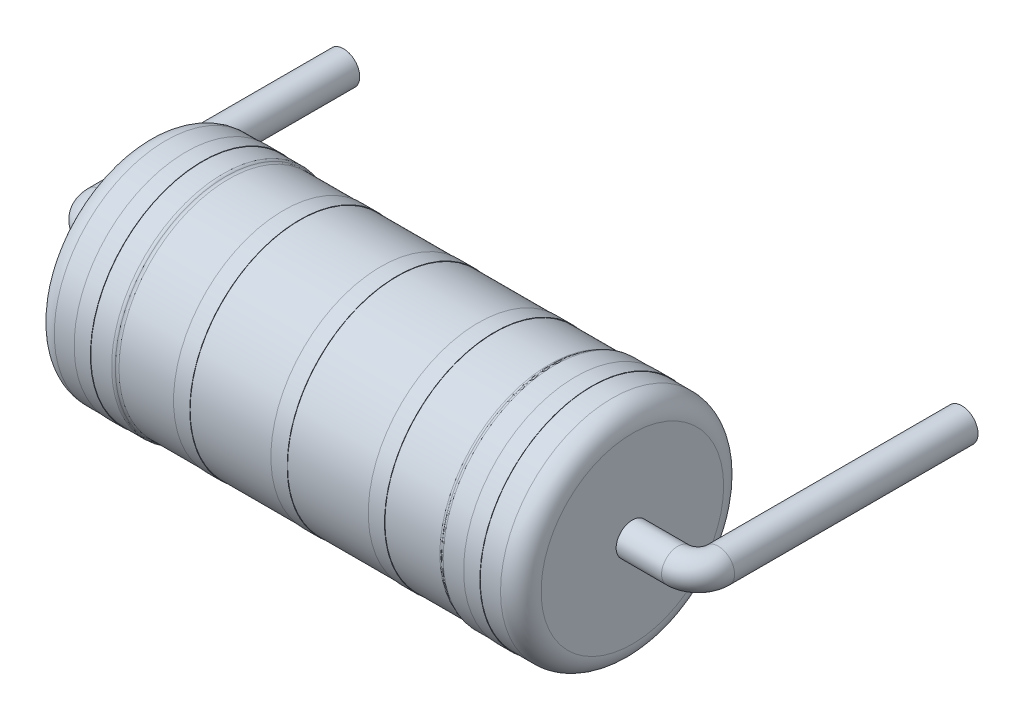
from build123d import *

# Parameters (mm, degrees)
SKETCH_1_R          = 2.75
EXTRUDE_1_DEPTH     = 6
SKETCH_5_OUTSIDE_W  = 10.36
SKETCH_5_OUTSIDE_H  = 10.36
SKETCH_5_OUTSIDE_R  = 2.7
CUT_EXTRUDE_2_DEPTH = 4
FILLET_10_R         = 0.1
FILLET_11_R         = 0.1
FILLET_13_R         = 0.5
SKETCH_6_R          = 2.76
EXTRUDE_2_DEPTH     = 0.2
SKETCH_7_R          = 2.76
EXTRUDE_3_DEPTH     = 0.2
SKETCH_8_R          = 2.71
EXTRUDE_4_DEPTH     = 0.2
SKETCH_9_R          = 2.71
EXTRUDE_5_DEPTH     = 0.2
SKETCH_10_R         = 2.71
EXTRUDE_6_DEPTH     = 0.2
SKETCH_13_R         = 0.4


with BuildPart() as part:
    # 草图1 → 拉伸1 (new, symmetric)
    with BuildSketch(Plane(origin=(0, 0, 0), x_dir=(0, 0, -1), z_dir=(1, 0, 0))):
        with Locations((-4.5, 0)):
            Circle(SKETCH_1_R)
    extrude(amount=EXTRUDE_1_DEPTH, both=True)

    # 草图5 outside → 切除-拉伸2 (cut, symmetric)
    with BuildSketch(Plane(origin=(0, 0, 0), x_dir=(0, 0, -1), z_dir=(1, 0, 0))):
        with Locations((-4.5, 0)):
            Rectangle(SKETCH_5_OUTSIDE_W, SKETCH_5_OUTSIDE_H)
        with Locations((-4.5, 0)):
            Circle(SKETCH_5_OUTSIDE_R, mode=Mode.SUBTRACT)
    extrude(amount=CUT_EXTRUDE_2_DEPTH, both=True, mode=Mode.SUBTRACT)

    # 圆角10
    # the kernel refuses this fillet: 0.1 mm, written as the material it takes off along each edge
    with BuildSketch(Plane(origin=(4, 0, 4.5), x_dir=(0, 0, -1), z_dir=(0, -1, 0))) as fillet_10_piece_1:
        with BuildLine():
            CenterArc((2.65, 0.08660254), FILLET_10_R, 300, 60)
            Line((2.75, 0.08660254), (2.752, 0.08660254))
            Line((2.752, 0.08660254), (2.752, 0))
            Line((2.752, 0), (2.75, -0.002))
            ThreePointArc((2.75, -0.002), (2.725, -0.002), (2.701, -0.001732051))
            Line((2.701, -0.001732051), (2.7, 0))
        make_face()
    revolve(axis=Axis((4, 0, 4.5), (1, 0, 0)), mode=Mode.SUBTRACT)
    with BuildSketch(Plane(origin=(-4, 0, 4.5), x_dir=(0, 0, -1), z_dir=(0, -1, 0))) as fillet_10_piece_2:
        with BuildLine():
            CenterArc((2.65, -0.08660254), FILLET_10_R, 0, 60)
            Line((2.7, 0), (2.701, 0.001732051))
            ThreePointArc((2.701, 0.001732051), (2.725, 0.002), (2.75, 0.002))
            Line((2.75, 0.002), (2.752, 0))
            Line((2.752, 0), (2.752, -0.08660254))
            Line((2.752, -0.08660254), (2.75, -0.08660254))
        make_face()
    revolve(axis=Axis((-4, 0, 4.5), (1, 0, 0)), mode=Mode.SUBTRACT)

    # 圆角11
    fillet_11_edges = [part.edges().sort_by_distance(p)[0] for p in [
        (4, 0, 7.2),
        (-4, 0, 7.2),
    ]]
    fillet(fillet_11_edges, radius=FILLET_11_R)

    # 圆角13
    fillet_13_edges = [part.edges().sort_by_distance(p)[0] for p in [
        (-6, 0, 7.25),
        (6, 0, 7.25),
    ]]
    fillet(fillet_13_edges, radius=FILLET_13_R)

    # 扫描1: sweep along a path in 草图12
    with BuildLine(Plane(origin=(0, 0, 0), x_dir=(1, 0, 0), z_dir=(0, 1, 0))) as sweep_1_path:
        Line((-6, -4.5), (-7.12, -4.5))
        ThreePointArc((-7.12, -4.5), (-7.473553391, -4.353553391), (-7.62, -4))
        Line((-7.62, -4), (-7.62, 2))
    # 草图13 → 扫描1 (sweep)
    with BuildSketch(Plane(origin=(-6, 0, 0), x_dir=(0, 0, -1), z_dir=(1, 0, 0))):
        with Locations((-4.5, 0)):
            Circle(SKETCH_13_R)
    sweep_1 = sweep(path=sweep_1_path.line)

    # 镜向3: 扫描1 across plane
    add(sweep_1.mirror(Plane(origin=(0, 0, 0), x_dir=(0, 0, 1), z_dir=(1, 0, 0))))


with BuildPart() as body_2:
    # 草图6 → 拉伸2 (new, symmetric)
    with BuildSketch(Plane(origin=(4.8, 0, 0), x_dir=(0, 0, -1), z_dir=(1, 0, 0))):
        with Locations((-4.5, 0)):
            Circle(SKETCH_6_R)
    extrude(amount=EXTRUDE_2_DEPTH, both=True)


with BuildPart() as body_3:
    # 草图7 → 拉伸3 (new, symmetric)
    with BuildSketch(Plane(origin=(-4.8, 0, 0), x_dir=(0, 0, -1), z_dir=(1, 0, 0))):
        with Locations((-4.5, 0)):
            Circle(SKETCH_7_R)
    extrude(amount=EXTRUDE_3_DEPTH, both=True)


with BuildPart() as body_4:
    # 草图8 → 拉伸4 (new, symmetric)
    with BuildSketch(Plane(origin=(2.4, 0, 0), x_dir=(0, 0, -1), z_dir=(1, 0, 0))):
        with Locations((-4.5, 0)):
            Circle(SKETCH_8_R)
    extrude(amount=EXTRUDE_4_DEPTH, both=True)


with BuildPart() as body_5:
    # 草图9 → 拉伸5 (new, symmetric)
    with BuildSketch(Plane(origin=(-2.4, 0, 0), x_dir=(0, 0, -1), z_dir=(1, 0, 0))):
        with Locations((-4.5, 0)):
            Circle(SKETCH_9_R)
    extrude(amount=EXTRUDE_5_DEPTH, both=True)


with BuildPart() as body_6:
    # 草图10 → 拉伸6 (new, symmetric)
    with BuildSketch(Plane(origin=(0, 0, 0), x_dir=(0, 0, -1), z_dir=(1, 0, 0))):
        with Locations((-4.5, 0)):
            Circle(SKETCH_10_R)
    extrude(amount=EXTRUDE_6_DEPTH, both=True)


solid = Compound([part.part, body_2.part, body_3.part, body_4.part, body_5.part, body_6.part])
